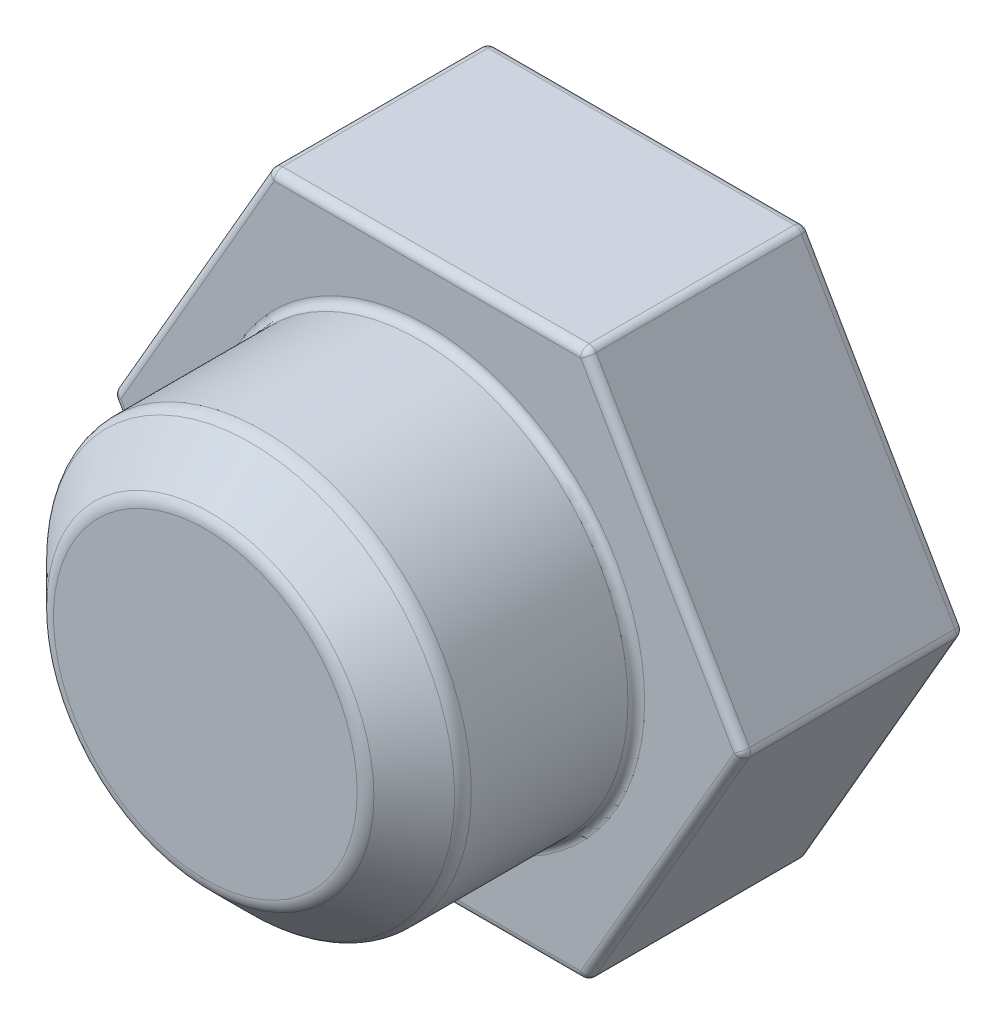
from build123d import *

# Parameters (mm, degrees)
SKETCH1_R           = 12.5
BOSS_EXTRUDE1_DEPTH = 13.29
SKETCH2_R           = 12.5
BOSS_EXTRUDE2_DEPTH = 13
BOSS_EXTRUDE3_START = 13.29
SKETCH2_2_R         = 12.5
BOSS_EXTRUDE3_DEPTH = 13.29
CHAMFER1_SIZE       = 3
FILLET1_R           = 1
FILLET2_R           = 0.5
FILLET3_R           = 0.5


with BuildPart() as part:
    # Sketch1 → Boss-Extrude1 (new body)
    with BuildSketch(Plane.XY):
        Polygon((18.918054635, 0), (9.459027317, 16.383515904), (-9.459027317, 16.383515904), (-18.918054635, 0), (-9.459027317, -16.383515904), (9.459027317, -16.383515904), align=None)
        Circle(SKETCH1_R, mode=Mode.SUBTRACT)
    extrude(amount=-BOSS_EXTRUDE1_DEPTH)

    # Sketch2 → Boss-Extrude2 (add)
    with BuildSketch(Plane.XY):
        Circle(SKETCH2_R)
    extrude(amount=-BOSS_EXTRUDE2_DEPTH)

    # Sketch2<2> → Boss-Extrude3 (add)
    with BuildSketch(Plane.XY.offset(BOSS_EXTRUDE3_START)):
        Circle(SKETCH2_2_R)
    extrude(amount=-BOSS_EXTRUDE3_DEPTH)

    # Chamfer1
    chamfer1_edges = [part.edges().sort_by_distance(p)[0] for p in [
        (-12.5, 0, 13.29),
    ]]
    chamfer(chamfer1_edges, length=CHAMFER1_SIZE)

    # Fillet1
    fillet1_edges = [part.edges().sort_by_distance(p)[0] for p in [
        (-9.5, 0, 13.29),
        (-12.5, 0, 10.29),
    ]]
    fillet(fillet1_edges, radius=FILLET1_R)

    # Fillet2
    # the kernel refuses this fillet: 0.5 mm, written as the material it takes off along each edge
    with BuildSketch(Plane(origin=(9.170352183, -15.883515904, -0.5), x_dir=(0.866025403784439, -0.4999999999999994, 0), z_dir=(0, 0, 1))) as fillet2_piece_1_section:
        Polygon((0, 0), (FILLET2_R * 1.02, 0), (FILLET2_R * 1.02, -FILLET2_R * 0.588897274573), (FILLET2_R * 0.51, -FILLET2_R * 0.88334591186), align=None)
    fillet2_piece_1 = extrude(amount=FILLET2_R * 1.02, mode=Mode.PRIVATE)
    fillet2_piece_1 = fillet2_piece_1 - Plane(origin=(9.170352183, -15.883515904, -0.5), x_dir=(-0.5000000000000004, 0.8660254037844384, 0), z_dir=(0, 0, 1)) * Sphere(FILLET2_R, mode=Mode.PRIVATE)
    add(fillet2_piece_1, mode=Mode.SUBTRACT)
    with BuildSketch(Plane(origin=(9.170352183, -15.883515904, -12.79), x_dir=(0.866025403784439, -0.4999999999999994, 0), z_dir=(0, 0, -1))) as fillet2_piece_2_section:
        Polygon((0, 0), (FILLET2_R * 1.02, 0), (FILLET2_R * 1.02, FILLET2_R * 0.588897274573), (FILLET2_R * 0.51, FILLET2_R * 0.88334591186), align=None)
    fillet2_piece_2 = extrude(amount=FILLET2_R * 1.02, mode=Mode.PRIVATE)
    fillet2_piece_2 = fillet2_piece_2 - Plane(origin=(9.170352183, -15.883515904, -12.79), x_dir=(-0.5000000000000004, 0.8660254037844384, 0), z_dir=(0, 0, -1)) * Sphere(FILLET2_R, mode=Mode.PRIVATE)
    add(fillet2_piece_2, mode=Mode.SUBTRACT)
    with BuildSketch(Plane(origin=(-9.170352183, -15.883515904, -0.5), x_dir=(0, -1, 0), z_dir=(0, 0, 1))) as fillet2_piece_3_section:
        Polygon((0, 0), (FILLET2_R * 1.02, 0), (FILLET2_R * 1.02, -FILLET2_R * 0.588897274573), (FILLET2_R * 0.51, -FILLET2_R * 0.88334591186), align=None)
    fillet2_piece_3 = extrude(amount=FILLET2_R * 1.02, mode=Mode.PRIVATE)
    fillet2_piece_3 = fillet2_piece_3 - Plane(origin=(-9.170352183, -15.883515904, -0.5), x_dir=(0.49999999999999983, 0.8660254037844387, 0), z_dir=(0, 0, 1)) * Sphere(FILLET2_R, mode=Mode.PRIVATE)
    add(fillet2_piece_3, mode=Mode.SUBTRACT)
    with BuildSketch(Plane(origin=(-9.170352183, -15.883515904, -12.79), x_dir=(0, -1, 0), z_dir=(0, 0, -1))) as fillet2_piece_4_section:
        Polygon((0, 0), (FILLET2_R * 1.02, 0), (FILLET2_R * 1.02, FILLET2_R * 0.588897274573), (FILLET2_R * 0.51, FILLET2_R * 0.88334591186), align=None)
    fillet2_piece_4 = extrude(amount=FILLET2_R * 1.02, mode=Mode.PRIVATE)
    fillet2_piece_4 = fillet2_piece_4 - Plane(origin=(-9.170352183, -15.883515904, -12.79), x_dir=(0.49999999999999983, 0.8660254037844387, 0), z_dir=(0, 0, -1)) * Sphere(FILLET2_R, mode=Mode.PRIVATE)
    add(fillet2_piece_4, mode=Mode.SUBTRACT)
    with BuildSketch(Plane(origin=(-18.340704365, 0, -0.5), x_dir=(-0.8660254037844388, 0.49999999999999967, 0), z_dir=(0, 0, 1))) as fillet2_piece_5_section:
        Polygon((0, 0), (FILLET2_R * 1.02, 0), (FILLET2_R * 1.02, FILLET2_R * 0.588897274573), (FILLET2_R * 0.51, FILLET2_R * 0.88334591186), align=None)
    fillet2_piece_5 = extrude(amount=FILLET2_R * 1.02, mode=Mode.PRIVATE)
    fillet2_piece_5 = fillet2_piece_5 - Plane(origin=(-18.340704365, 0, -0.5), x_dir=(1, 0, 0), z_dir=(0, 0, 1)) * Sphere(FILLET2_R, mode=Mode.PRIVATE)
    add(fillet2_piece_5, mode=Mode.SUBTRACT)
    with BuildSketch(Plane(origin=(-18.340704365, 0, -12.79), x_dir=(-0.8660254037844388, 0.49999999999999967, 0), z_dir=(0, 0, -1))) as fillet2_piece_6_section:
        Polygon((0, 0), (FILLET2_R * 1.02, 0), (FILLET2_R * 1.02, -FILLET2_R * 0.588897274573), (FILLET2_R * 0.51, -FILLET2_R * 0.88334591186), align=None)
    fillet2_piece_6 = extrude(amount=FILLET2_R * 1.02, mode=Mode.PRIVATE)
    fillet2_piece_6 = fillet2_piece_6 - Plane(origin=(-18.340704365, 0, -12.79), x_dir=(1, 0, 0), z_dir=(0, 0, -1)) * Sphere(FILLET2_R, mode=Mode.PRIVATE)
    add(fillet2_piece_6, mode=Mode.SUBTRACT)
    with BuildSketch(Plane(origin=(-9.170352183, 15.883515904, -0.5), x_dir=(0, 1, 0), z_dir=(0, 0, 1))) as fillet2_piece_7_section:
        Polygon((0, 0), (FILLET2_R * 1.02, 0), (FILLET2_R * 1.02, FILLET2_R * 0.588897274573), (FILLET2_R * 0.51, FILLET2_R * 0.88334591186), align=None)
    fillet2_piece_7 = extrude(amount=FILLET2_R * 1.02, mode=Mode.PRIVATE)
    fillet2_piece_7 = fillet2_piece_7 - Plane(origin=(-9.170352183, 15.883515904, -0.5), x_dir=(0.5000000000000002, -0.8660254037844386, 0), z_dir=(0, 0, 1)) * Sphere(FILLET2_R, mode=Mode.PRIVATE)
    add(fillet2_piece_7, mode=Mode.SUBTRACT)
    with BuildSketch(Plane(origin=(-9.170352183, 15.883515904, -12.79), x_dir=(0, 1, 0), z_dir=(0, 0, -1))) as fillet2_piece_8_section:
        Polygon((0, 0), (FILLET2_R * 1.02, 0), (FILLET2_R * 1.02, -FILLET2_R * 0.588897274573), (FILLET2_R * 0.51, -FILLET2_R * 0.88334591186), align=None)
    fillet2_piece_8 = extrude(amount=FILLET2_R * 1.02, mode=Mode.PRIVATE)
    fillet2_piece_8 = fillet2_piece_8 - Plane(origin=(-9.170352183, 15.883515904, -12.79), x_dir=(0.5000000000000002, -0.8660254037844386, 0), z_dir=(0, 0, -1)) * Sphere(FILLET2_R, mode=Mode.PRIVATE)
    add(fillet2_piece_8, mode=Mode.SUBTRACT)
    with BuildSketch(Plane(origin=(9.170352183, 15.883515904, -0.5), x_dir=(0.8660254037844384, 0.5000000000000006, 0), z_dir=(0, 0, 1))) as fillet2_piece_9_section:
        Polygon((0, 0), (FILLET2_R * 1.02, 0), (FILLET2_R * 1.02, FILLET2_R * 0.588897274573), (FILLET2_R * 0.51, FILLET2_R * 0.88334591186), align=None)
    fillet2_piece_9 = extrude(amount=FILLET2_R * 1.02, mode=Mode.PRIVATE)
    fillet2_piece_9 = fillet2_piece_9 - Plane(origin=(9.170352183, 15.883515904, -0.5), x_dir=(-0.4999999999999997, -0.8660254037844387, 0), z_dir=(0, 0, 1)) * Sphere(FILLET2_R, mode=Mode.PRIVATE)
    add(fillet2_piece_9, mode=Mode.SUBTRACT)
    with BuildSketch(Plane(origin=(9.170352183, 15.883515904, -12.79), x_dir=(0.8660254037844384, 0.5000000000000006, 0), z_dir=(0, 0, -1))) as fillet2_piece_10_section:
        Polygon((0, 0), (FILLET2_R * 1.02, 0), (FILLET2_R * 1.02, -FILLET2_R * 0.588897274573), (FILLET2_R * 0.51, -FILLET2_R * 0.88334591186), align=None)
    fillet2_piece_10 = extrude(amount=FILLET2_R * 1.02, mode=Mode.PRIVATE)
    fillet2_piece_10 = fillet2_piece_10 - Plane(origin=(9.170352183, 15.883515904, -12.79), x_dir=(-0.4999999999999997, -0.8660254037844387, 0), z_dir=(0, 0, -1)) * Sphere(FILLET2_R, mode=Mode.PRIVATE)
    add(fillet2_piece_10, mode=Mode.SUBTRACT)
    with BuildSketch(Plane(origin=(18.340704365, 0, -0.5), x_dir=(0.8660254037844384, 0.5000000000000006, 0), z_dir=(0, 0, 1))) as fillet2_piece_11_section:
        Polygon((0, 0), (FILLET2_R * 1.02, 0), (FILLET2_R * 1.02, -FILLET2_R * 0.588897274573), (FILLET2_R * 0.51, -FILLET2_R * 0.88334591186), align=None)
    fillet2_piece_11 = extrude(amount=FILLET2_R * 1.02, mode=Mode.PRIVATE)
    fillet2_piece_11 = fillet2_piece_11 - Plane(origin=(18.340704365, 0, -0.5), x_dir=(-1, 0, 0), z_dir=(0, 0, 1)) * Sphere(FILLET2_R, mode=Mode.PRIVATE)
    add(fillet2_piece_11, mode=Mode.SUBTRACT)
    with BuildSketch(Plane(origin=(18.340704365, 0, -12.79), x_dir=(0.8660254037844384, 0.5000000000000006, 0), z_dir=(0, 0, -1))) as fillet2_piece_12_section:
        Polygon((0, 0), (FILLET2_R * 1.02, 0), (FILLET2_R * 1.02, FILLET2_R * 0.588897274573), (FILLET2_R * 0.51, FILLET2_R * 0.88334591186), align=None)
    fillet2_piece_12 = extrude(amount=FILLET2_R * 1.02, mode=Mode.PRIVATE)
    fillet2_piece_12 = fillet2_piece_12 - Plane(origin=(18.340704365, 0, -12.79), x_dir=(-1, 0, 0), z_dir=(0, 0, -1)) * Sphere(FILLET2_R, mode=Mode.PRIVATE)
    add(fillet2_piece_12, mode=Mode.SUBTRACT)
    with BuildSketch(Plane(origin=(9.459027317, -16.383515904, -0.5), x_dir=(0.499999999999998, 0.8660254037844398, 0), z_dir=(0, 0, -1)), Plane(origin=(-9.459027317, -16.383515904, -0.5), x_dir=(1, 0, 0), z_dir=(0, 0, -1)), Plane(origin=(18.918054635, 0, -0.5), x_dir=(-0.500000000000001, 0.8660254037844382, 0), z_dir=(0, 0, -1))) as fillet2_piece_13:
        with BuildLine():
            CenterArc((FILLET2_R * 0.57735026919, -FILLET2_R), FILLET2_R, 90, 60)
            Line((-FILLET2_R * 0.288675134595, -FILLET2_R * 0.5), (-FILLET2_R * 0.305995642671, -FILLET2_R * 0.49))
            Line((-FILLET2_R * 0.305995642671, -FILLET2_R * 0.49), (-FILLET2_R * 0.0115470053838, FILLET2_R * 0.02))
            Line((-FILLET2_R * 0.0115470053838, FILLET2_R * 0.02), (FILLET2_R * 0.57735026919, FILLET2_R * 0.02))
            Line((FILLET2_R * 0.57735026919, FILLET2_R * 0.02), (FILLET2_R * 0.57735026919, 0))
        make_face()
    extrude(amount=12.29, mode=Mode.SUBTRACT)
    with BuildSketch(Plane(origin=(-18.918054635, 0, -0.5), x_dir=(0.49999999999999345, 0.8660254037844424, 0), z_dir=(0, 0, -1)), Plane(origin=(-9.459027317, 16.383515904, -0.5), x_dir=(1, 0, 0), z_dir=(0, 0, -1)), Plane(origin=(9.459027317, 16.383515904, -0.5), x_dir=(0.499999999999998, -0.8660254037844398, 0), z_dir=(0, 0, -1))) as fillet2_piece_14:
        with BuildLine():
            CenterArc((FILLET2_R * 0.57735026919, FILLET2_R), FILLET2_R, 210, 60)
            Line((-FILLET2_R * 0.288675134595, FILLET2_R * 0.5), (-FILLET2_R * 0.30599564267, FILLET2_R * 0.49))
            Line((-FILLET2_R * 0.30599564267, FILLET2_R * 0.49), (-FILLET2_R * 0.0115470053838, -FILLET2_R * 0.02))
            Line((-FILLET2_R * 0.0115470053838, -FILLET2_R * 0.02), (FILLET2_R * 0.57735026919, -FILLET2_R * 0.02))
            Line((FILLET2_R * 0.57735026919, -FILLET2_R * 0.02), (FILLET2_R * 0.57735026919, 0))
        make_face()
    extrude(amount=12.29, mode=Mode.SUBTRACT)
    with BuildSketch(Plane(origin=(9.170352183, 16.383515904, -13.29), x_dir=(0, 0, 1), z_dir=(-1, 0, 0)), Plane(origin=(-9.603364885, 16.133515904, -13.29), x_dir=(0, 0, 1), z_dir=(-0.4999999999999997, -0.8660254037844389, 0)), Plane(origin=(-18.773717067, -0.25, -13.29), x_dir=(0, 0, 1), z_dir=(0.5000000000000002, -0.8660254037844386, 0)), Plane(origin=(-9.170352183, -16.383515904, -13.29), x_dir=(0, 0, 1), z_dir=(1, 0, 0)), Plane(origin=(9.603364885, -16.133515904, -13.29), x_dir=(0, 0, 1), z_dir=(0.4999999999999994, 0.866025403784439, 0)), Plane(origin=(-9.170352183, -16.383515904, 0), x_dir=(0, 1, 0), z_dir=(1, 0, 0)), Plane(origin=(-18.773717067, -0.25, 0), x_dir=(0.8660254037844386, 0.5000000000000002, 0), z_dir=(0.5000000000000002, -0.8660254037844386, 0)), Plane(origin=(-9.603364885, 16.133515904, 0), x_dir=(0.8660254037844388, -0.49999999999999967, 0), z_dir=(-0.4999999999999997, -0.8660254037844389, 0)), Plane(origin=(9.170352183, 16.383515904, 0), x_dir=(0, -1, 0), z_dir=(-1, 0, 0)), Plane(origin=(18.773717067, 0.25, 0), x_dir=(-0.8660254037844384, -0.5000000000000006, 0), z_dir=(-0.5000000000000006, 0.8660254037844384, 0)), Plane(origin=(9.603364885, -16.133515904, 0), x_dir=(-0.866025403784439, 0.49999999999999933, 0), z_dir=(0.4999999999999994, 0.866025403784439, 0)), Plane(origin=(18.773717067, 0.25, -13.29), x_dir=(0, 0, 1), z_dir=(-0.5000000000000006, 0.8660254037844384, 0))) as fillet2_piece_15:
        with BuildLine():
            CenterArc((FILLET2_R, -FILLET2_R), FILLET2_R, 90, 90)
            Line((0, -FILLET2_R), (-FILLET2_R * 0.02, -FILLET2_R))
            Line((-FILLET2_R * 0.02, -FILLET2_R), (-FILLET2_R * 0.02, FILLET2_R * 0.02))
            Line((-FILLET2_R * 0.02, FILLET2_R * 0.02), (FILLET2_R, FILLET2_R * 0.02))
            Line((FILLET2_R, FILLET2_R * 0.02), (FILLET2_R, 0))
        make_face()
    extrude(amount=18.340704365, mode=Mode.SUBTRACT)
    with BuildSketch(Plane(origin=(0, 0, -13.29), x_dir=(1, 0, 0), z_dir=(0, -1, 0))) as fillet2_piece_16:
        with BuildLine():
            CenterArc((12.953762052, 0.5), FILLET2_R, 204.83458749, 65.16541251)
            Line((12.5, 0.29), (12.490924759, 0.2858))
            ThreePointArc((12.490924759, 0.2858), (12.49, 0.145), (12.49, 0))
            Line((12.49, 0), (12.5, -0.01))
            Line((12.5, -0.01), (12.953762052, -0.01))
            Line((12.953762052, -0.01), (12.953762052, 0))
        make_face()
    revolve(axis=Axis((0, 0, -13.29), (0, 0, 1)), mode=Mode.SUBTRACT)

    # Fillet3
    fillet3_edges = [part.edges().sort_by_distance(p)[0] for p in [
        (-12.5, 0, 0),
    ]]
    fillet(fillet3_edges, radius=FILLET3_R)


solid = part.part
